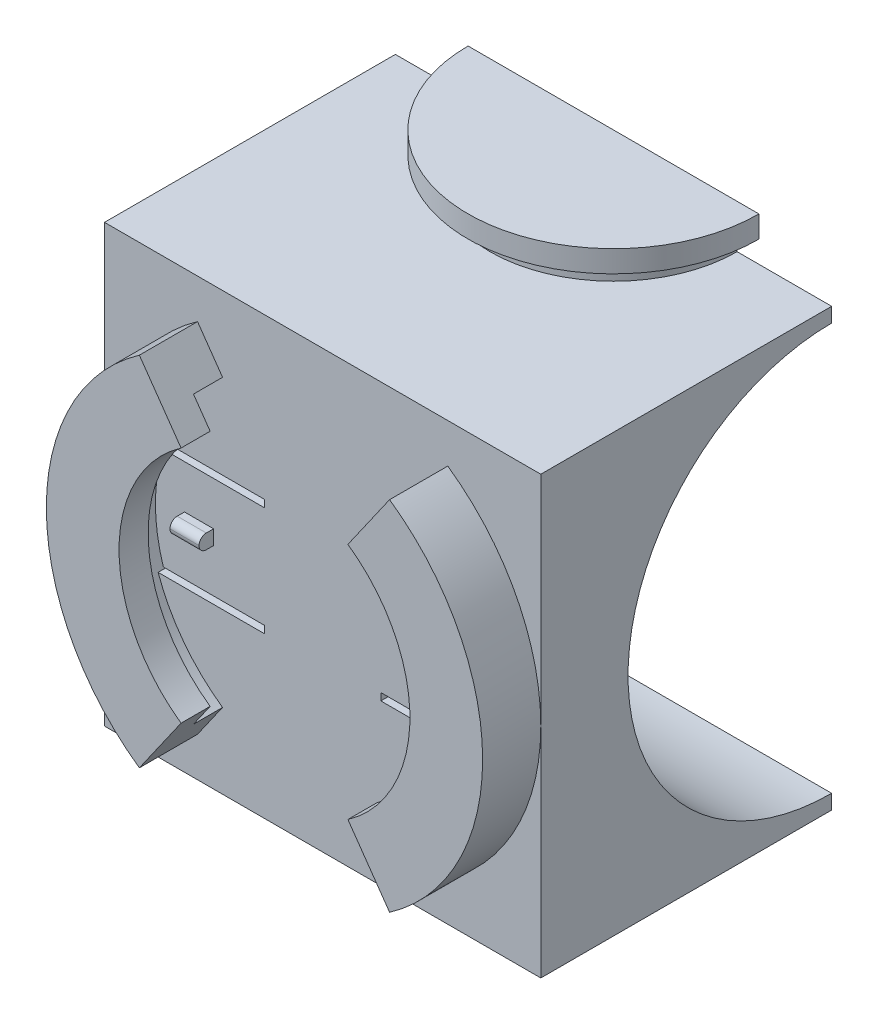
from build123d import *

# Parameters (mm, degrees)
SKETCH4_W           = 30
SKETCH4_H           = 30
BOSS_EXTRUDE2_DEPTH = 20
SKETCH5_R           = 14
CUT_EXTRUDE1_DEPTH  = 47.904157598
SKETCH6_W           = 2
SKETCH6_H           = 1
BOSS_EXTRUDE3_DEPTH = 1
SHELL6_START        = 2
SHELL6_DEPTH        = 26
FILLET1_R           = 0.5
CUT_EXTRUDE2_DEPTH  = 4
CUT_EXTRUDE11_START = -2
CUT_EXTRUDE11_DEPTH = 2
BOSS_EXTRUDE4_DEPTH = 3
SKETCH12_W          = 1.5
SKETCH12_H          = 1.5


# Read off the part's stored shape, not the designer's step: Shell6
with BuildPart() as part:
    # Sketch4 → Boss-Extrude2 (new body)
    with BuildSketch(Plane.XY):
        with Locations((15, 15)):
            Rectangle(SKETCH4_W, SKETCH4_H)
    extrude(amount=-BOSS_EXTRUDE2_DEPTH)

    # Sketch5 → Cut-Extrude1 (cut, through all)
    with BuildSketch(Plane(origin=(30, 0, 0), x_dir=(0, 0, -1), z_dir=(1, 0, 0))):
        with Locations((20, 15)):
            Circle(SKETCH5_R)
    extrude(amount=-CUT_EXTRUDE1_DEPTH, mode=Mode.SUBTRACT)

    # Sketch6 → Boss-Extrude3 (add)
    with BuildSketch(Plane.XY):
        with Locations((23.5, 15)):
            Rectangle(SKETCH6_W, SKETCH6_H)
        with Locations((6.5, 15)):
            Rectangle(SKETCH6_W, SKETCH6_H)
    extrude(amount=BOSS_EXTRUDE3_DEPTH)

    # Shell6 outline → Shell6 (cut)
    with BuildSketch(Plane.YZ.offset(SHELL6_START)):
        with BuildLine():
            Line((28, -2), (2, -2))
            Line((2, -2), (2, -10.672620947))
            ThreePointArc((2, -10.672620947), (15, -4), (28, -10.672620947))
            Line((28, -10.672620947), (28, -2))
        make_face()
    extrude(amount=SHELL6_DEPTH, mode=Mode.SUBTRACT)

    # Fillet1
    fillet1_edges = [part.edges().sort_by_distance(p)[0] for p in [
        (23.5, 15.5, 1),
        (23.5, 14.5, 1),
        (6.5, 15.5, 1),
        (6.5, 14.5, 1),
    ]]
    fillet(fillet1_edges, radius=FILLET1_R - 0.0001)  # a hair under: the kernel refuses the full size

    # Sketch7 → Revolve1 (revolve)
    with BuildSketch(Plane(origin=(0, 15, 0), x_dir=(-1, 0, 0), z_dir=(0, -1, 0))):
        Polygon((0, 0), (0, -4), (-5, -4), (-5, -2), (-3, -2), (-3, 0), align=None)
    revolve(axis=Axis((15, 15, 0), (0, 0, 1)))

    # Sketch9 → Cut-Extrude2 (cut)
    with BuildSketch(Plane.XY.offset(4)):
        with BuildLine():
            Line((6.396353455, 27.287280664), (9.264235636, 23.191520443))
            ThreePointArc((9.264235636, 23.191520443), (15, 25), (20.735764364, 23.191520443))
            Line((20.735764364, 23.191520443), (23.603646545, 27.287280664))
            ThreePointArc((23.603646545, 27.287280664), (15, 30), (6.396353455, 27.287280664))
        make_face()
    cut_extrude2 = extrude(amount=-CUT_EXTRUDE2_DEPTH, mode=Mode.SUBTRACT)

    # Mirror1: Cut-Extrude2 across plane
    add(cut_extrude2.mirror(Plane(origin=(0, 15, 0), x_dir=(0, 0, 1), z_dir=(0, -1, 0))), mode=Mode.SUBTRACT)

    # Sketch10 → Cut-Extrude11 (cut)
    with BuildSketch(Plane.XY.offset(CUT_EXTRUDE11_START)):
        with BuildLine():
            Line((11, 19), (3.686291501, 19))
            ThreePointArc((3.686291501, 19), (3, 15), (3.686291501, 11))
            Line((3.686291501, 11), (11, 11))
            Line((11, 11), (11, 11.5))
            Line((11, 11.5), (4.04554885, 11.5))
            ThreePointArc((4.04554885, 11.5), (3.5, 15), (4.04554885, 18.5))
            Line((4.04554885, 18.5), (11, 18.5))
            Line((11, 18.5), (11, 19))
        make_face()
        with BuildLine():
            Line((26.313708499, 19), (19, 19))
            Line((19, 19), (19, 18.5))
            Line((19, 18.5), (25.95445115, 18.5))
            ThreePointArc((25.95445115, 18.5), (26.5, 15), (25.95445115, 11.5))
            Line((25.95445115, 11.5), (19, 11.5))
            Line((19, 11.5), (19, 11))
            Line((19, 11), (26.313708499, 11))
            ThreePointArc((26.313708499, 11), (27, 15), (26.313708499, 19))
        make_face()
    extrude(amount=CUT_EXTRUDE11_DEPTH, mode=Mode.SUBTRACT)

    # Sketch11 → Boss-Extrude4 (add)
    with BuildSketch(Plane(origin=(0, 30, 0), x_dir=(1, 0, 0), z_dir=(0, 1, 0))):
        with BuildLine():
            Line((25, 20), (5, 20))
            ThreePointArc((5, 20), (15, 10), (25, 20))
        make_face()
    boss_extrude4 = extrude(amount=BOSS_EXTRUDE4_DEPTH)

    # Sketch12 → Cut-Revolve1 (revolve, cut)
    with BuildSketch(Plane(origin=(0, 0, -20), x_dir=(-1, 0, 0), z_dir=(0, 0, -1))):
        with Locations((-5.75, 30.75)):
            Rectangle(SKETCH12_W, SKETCH12_H)
    cut_revolve1 = revolve(axis=Axis((15, 33, -20), (0, -1, 0)), mode=Mode.SUBTRACT)

    # Mirror2: Boss-Extrude4, Cut-Revolve1 across plane
    add(boss_extrude4.mirror(Plane(origin=(0, 15, 0), x_dir=(0, 0, 1), z_dir=(0, -1, 0))))
    add(cut_revolve1.mirror(Plane(origin=(0, 15, 0), x_dir=(0, 0, 1), z_dir=(0, -1, 0))), mode=Mode.SUBTRACT)


solid = part.part
